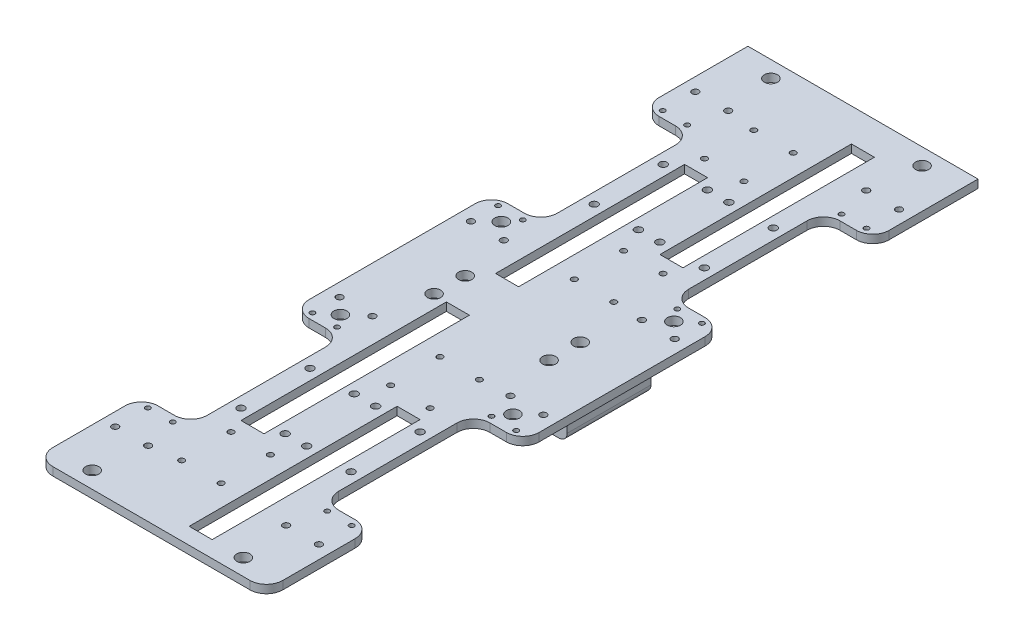
from build123d import *

# Parameters (mm, degrees)
SKETCH1_W           = 140
SKETCH1_H           = 340
BOSS_EXTRUDE1_DEPTH = 5
SKETCH3_W           = 30
SKETCH3_H           = 80
CUT_EXTRUDE1_DEPTH  = 184.915741577
SKETCH6_R           = 2.25
CUT_EXTRUDE2_DEPTH  = 184.915741577
SKETCH9_W           = 14
SKETCH9_H           = 55
CUT_EXTRUDE3_DEPTH  = 184.915741577
SKETCH10_W          = 14
SKETCH10_H          = 70
SKETCH10_H_2        = 60
CUT_EXTRUDE4_DEPTH  = 184.915741577
SKETCH12_W          = 140
SKETCH12_H          = 20
BOSS_EXTRUDE2_DEPTH = 5
SKETCH14_R          = 1.5
CUT_EXTRUDE6_DEPTH  = 203.546291005
SKETCH15_W          = 30
SKETCH15_H          = 6
CUT_EXTRUDE7_DEPTH  = 203.546291005
FILLET1_R           = 10
FILLET2_R           = 10
SKETCH17_W          = 140
SKETCH17_H          = 216.5
BOSS_EXTRUDE3_DEPTH = 5
MIRROR2_OUTLINE_W   = 14
MIRROR2_OUTLINE_H   = 116.526971263
MIRROR2_OUTLINE_H_2 = 115
MIRROR2_OUTLINE_R   = 2.25
MIRROR2_OUTLINE_R_2 = 1.5
MIRROR2_DEPTH       = 5
SKETCH20_R          = 1.75
CUT_EXTRUDE8_DEPTH  = 253.956732982
SKETCH21_R          = 2
CUT_EXTRUDE9_DEPTH  = 253.956732982
SKETCH22_W          = 20
SKETCH22_H          = 51
BOSS_EXTRUDE4_DEPTH = 17
SKETCH23_R          = 4
CUT_EXTRUDE10_DEPTH = 62
SKETCH24_W          = 26
SKETCH24_H          = 51
BOSS_EXTRUDE5_DEPTH = 17
SKETCH25_R          = 4
CUT_EXTRUDE11_DEPTH = 62
FILLET6_R           = 5
SKETCH26_R          = 4
CUT_EXTRUDE12_DEPTH = 254.86238154
SKETCH27_W          = 14
SKETCH27_H          = 10
CUT_EXTRUDE13_DEPTH = 10


# Read off the part's stored shape, not the designer's step: Mirror2
with BuildPart() as part:
    # Sketch1 → Boss-Extrude1 (new body)
    with BuildSketch(Plane(origin=(0, 0, 0), x_dir=(1, 0, 0), z_dir=(0, 1, 0))):
        Rectangle(SKETCH1_W, SKETCH1_H)
    extrude(amount=BOSS_EXTRUDE1_DEPTH)

    # Sketch3 → Cut-Extrude1 (cut, through all)
    with BuildSketch(Plane(origin=(0, 5, 0), x_dir=(1, 0, 0), z_dir=(0, 1, 0))):
        with Locations((-55, -80)):
            Rectangle(SKETCH3_W, SKETCH3_H)
        with Locations((55, -80)):
            Rectangle(SKETCH3_W, SKETCH3_H)
    extrude(amount=-CUT_EXTRUDE1_DEPTH, mode=Mode.SUBTRACT)

    # Sketch6 → Cut-Extrude2 (cut, through all)
    with BuildSketch(Plane(origin=(0, 0, 0), x_dir=(-1, 0, 0), z_dir=(0, -1, 0))):
        with Locations(Location((-33.5, -59.973028737, 0), (0, 0, 90))):
            Circle(SKETCH6_R)
        with Locations(Location((-33.5, -101.973028737, 0), (0, 0, 90))):
            Circle(SKETCH6_R)
        with Locations(Location((-6.446238439, -59.973028737, 0), (0, 0, 90))):
            Circle(SKETCH6_R)
        with Locations(Location((-6.446238439, -101.973028737, 0), (0, 0, 90))):
            Circle(SKETCH6_R)
        with Locations(Location((6.61862519, -101.973028737, 0), (0, 0, 90))):
            Circle(SKETCH6_R)
        with Locations(Location((6.61862519, -59.973028737, 0), (0, 0, 90))):
            Circle(SKETCH6_R)
        with Locations(Location((33.5, -59.973028737, 0), (0, 0, 90))):
            Circle(SKETCH6_R)
        with Locations(Location((33.5, -101.973028737, 0), (0, 0, 90))):
            Circle(SKETCH6_R)
    extrude(amount=-CUT_EXTRUDE2_DEPTH, mode=Mode.SUBTRACT)

    # Sketch9 → Cut-Extrude3 (cut, through all)
    with BuildSketch(Plane.XZ):
        with Locations((-20, 80.973028737)):
            Rectangle(SKETCH9_W, SKETCH9_H)
        with Locations((20, 80.973028737)):
            Rectangle(SKETCH9_W, SKETCH9_H)
    extrude(amount=-CUT_EXTRUDE3_DEPTH, mode=Mode.SUBTRACT)

    # Sketch10 → Cut-Extrude4 (cut, through all)
    with BuildSketch(Plane(origin=(0, 5, 0), x_dir=(1, 0, 0), z_dir=(0, 1, 0))):
        with Locations((20, -143.473028737)):
            Rectangle(SKETCH10_W, SKETCH10_H)
        with Locations((-20, -23.473028737)):
            Rectangle(SKETCH10_W, SKETCH10_H_2)
    extrude(amount=-CUT_EXTRUDE4_DEPTH, mode=Mode.SUBTRACT)

    # Sketch12 → Boss-Extrude2 (add)
    with BuildSketch(Plane(origin=(0, 0, 0), x_dir=(1, 0, 0), z_dir=(0, 1, 0))):
        with Locations((0, -180)):
            Rectangle(SKETCH12_W, SKETCH12_H)
    extrude(amount=BOSS_EXTRUDE2_DEPTH)

    # Sketch14 → Cut-Extrude6 (cut, through all)
    with BuildSketch(Plane(origin=(0, 5, 0), x_dir=(1, 0, 0), z_dir=(0, 1, 0))):
        with Locations(Location((-62, -30, 0), (0, 0, 270))):
            Circle(SKETCH14_R)
        with Locations(Location((-47, -30, 0), (0, 0, 270))):
            Circle(SKETCH14_R)
        with Locations(Location((47, -30, 0), (0, 0, 90))):
            Circle(SKETCH14_R)
        with Locations(Location((62, -30, 0), (0, 0, 90))):
            Circle(SKETCH14_R)
        with Locations(Location((-62, -130.169982871, 0), (0, 0, 270))):
            Circle(SKETCH14_R)
        with Locations(Location((-47, -130, 0), (0, 0, 270))):
            Circle(SKETCH14_R)
        with Locations(Location((47, -130, 0), (0, 0, 90))):
            Circle(SKETCH14_R)
        with Locations(Location((62, -130.169982871, 0), (0, 0, 90))):
            Circle(SKETCH14_R)
    extrude(amount=-CUT_EXTRUDE6_DEPTH, mode=Mode.SUBTRACT)

    # Sketch15 → Cut-Extrude7 (cut, through all)
    with BuildSketch(Plane(origin=(0, 5, 0), x_dir=(1, 0, 0), z_dir=(0, 1, 0))):
        with Locations((-55, -37)):
            Rectangle(SKETCH15_W, SKETCH15_H)
        with Locations((-55, -123)):
            Rectangle(SKETCH15_W, SKETCH15_H)
        with Locations((55, -37)):
            Rectangle(SKETCH15_W, SKETCH15_H)
        with Locations((55, -123)):
            Rectangle(SKETCH15_W, SKETCH15_H)
    extrude(amount=-CUT_EXTRUDE7_DEPTH, mode=Mode.SUBTRACT)

    # Fillet1
    fillet1_edges = [part.edges().sort_by_distance(p)[0] for p in [
        (-70, 2.5, 190),
        (70, 2.5, 190),
        (-70, 2.5, 126),
        (70, 2.5, 34),
        (70, 2.5, 126),
        (-70, 2.5, 34),
    ]]
    fillet(fillet1_edges, radius=FILLET1_R)

    # Fillet2
    fillet2_edges = [part.edges().sort_by_distance(p)[0] for p in [
        (-40, 2.5, 126),
        (40, 2.5, 34),
        (40, 2.5, 126),
        (-40, 2.5, 34),
    ]]
    fillet(fillet2_edges, radius=FILLET2_R)

    # Sketch17 → Boss-Extrude3 (add)
    with BuildSketch(Plane(origin=(0, 5, 0), x_dir=(1, 0, 0), z_dir=(0, 1, 0))):
        with Locations((0, 134.776971263)):
            Rectangle(SKETCH17_W, SKETCH17_H)
    extrude(amount=-BOSS_EXTRUDE3_DEPTH)

    # Mirror2 outline → Mirror2 (cut)
    with BuildSketch(Plane(origin=(0, 0, 0), x_dir=(1, 0, 0), z_dir=(0, 1, 0))):
        with BuildLine():
            Line((40, 169), (40, 97))
            ThreePointArc((40, 97), (42.928932188, 89.928932188), (50, 87))
            Line((50, 87), (60, 87))
            ThreePointArc((60, 87), (67.071067812, 84.071067812), (70, 77))
            Line((70, 77), (70, 189))
            ThreePointArc((70, 189), (67.071067812, 181.928932188), (60, 179))
            Line((60, 179), (50, 179))
            ThreePointArc((50, 179), (42.928932188, 176.071067812), (40, 169))
        make_face()
        with BuildLine():
            ThreePointArc((-50, 87), (-42.928932188, 89.928932188), (-40, 97))
            Line((-40, 97), (-40, 169))
            ThreePointArc((-40, 169), (-42.928932188, 176.071067812), (-50, 179))
            Line((-50, 179), (-60, 179))
            ThreePointArc((-60, 179), (-67.071067812, 181.928932188), (-70, 189))
            Line((-70, 189), (-70, 77))
            ThreePointArc((-70, 77), (-67.071067812, 84.071067812), (-60, 87))
            Line((-60, 87), (-50, 87))
        make_face()
        with Locations((20, 164.736514368)):
            Rectangle(MIRROR2_OUTLINE_W, MIRROR2_OUTLINE_H)
        with Locations((-20, 103.973028737)):
            Rectangle(MIRROR2_OUTLINE_W, MIRROR2_OUTLINE_H_2)
        with Locations((33.5, 112.973028737)):
            Circle(MIRROR2_OUTLINE_R)
        with Locations((-33.5, 154.973028737)):
            Circle(MIRROR2_OUTLINE_R)
        with Locations((-33.5, 112.973028737)):
            Circle(MIRROR2_OUTLINE_R)
        with Locations((-6.61862519, 112.973028737)):
            Circle(MIRROR2_OUTLINE_R)
        with Locations((33.5, 154.973028737)):
            Circle(MIRROR2_OUTLINE_R)
        with Locations((6.446238439, 112.973028737)):
            Circle(MIRROR2_OUTLINE_R)
        with Locations((6.446238439, 154.973028737)):
            Circle(MIRROR2_OUTLINE_R)
        with Locations((-6.61862519, 154.973028737)):
            Circle(MIRROR2_OUTLINE_R)
        with Locations((-62, 83)):
            Circle(MIRROR2_OUTLINE_R_2)
        with Locations((62, 183.169982871)):
            Circle(MIRROR2_OUTLINE_R_2)
        with Locations((47, 183)):
            Circle(MIRROR2_OUTLINE_R_2)
        with Locations((-47, 183)):
            Circle(MIRROR2_OUTLINE_R_2)
        with Locations((-47, 83)):
            Circle(MIRROR2_OUTLINE_R_2)
        with Locations((47, 83)):
            Circle(MIRROR2_OUTLINE_R_2)
        with Locations((62, 83)):
            Circle(MIRROR2_OUTLINE_R_2)
        with Locations((-62, 183.169982871)):
            Circle(MIRROR2_OUTLINE_R_2)
    extrude(amount=MIRROR2_DEPTH, mode=Mode.SUBTRACT)

    # Sketch20 → Cut-Extrude8 (cut, through all)
    with BuildSketch(Plane(origin=(0, 5, 0), x_dir=(1, 0, 0), z_dir=(0, 1, 0))):
        with Locations(Location((0, -14.373028737, 0), (0, 0, 270))):
            Circle(SKETCH20_R)
        with Locations(Location((24, -14.373028737, 0), (0, 0, 270))):
            Circle(SKETCH20_R)
        with Locations(Location((0, -44.373028737, 0), (0, 0, 270))):
            Circle(SKETCH20_R)
        with Locations(Location((24, -44.373028737, 0), (0, 0, 270))):
            Circle(SKETCH20_R)
        with Locations(Location((-24, -117.573028737, 0), (0, 0, 270))):
            Circle(SKETCH20_R)
        with Locations(Location((0, -117.573028737, 0), (0, 0, 270))):
            Circle(SKETCH20_R)
        with Locations(Location((-24, -147.573028737, 0), (0, 0, 270))):
            Circle(SKETCH20_R)
        with Locations(Location((0, -147.573028737, 0), (0, 0, 270))):
            Circle(SKETCH20_R)
    cut_extrude8 = extrude(amount=-CUT_EXTRUDE8_DEPTH, mode=Mode.SUBTRACT)

    # Sketch21 → Cut-Extrude9 (cut, through all)
    with BuildSketch(Plane(origin=(0, 5, 0), x_dir=(1, 0, 0), z_dir=(0, 1, 0))):
        with Locations(Location((-62, -13.473028737, 0), (0, 0, 270))):
            Circle(SKETCH21_R)
        with Locations(Location((-42, -13.473028737, 0), (0, 0, 270))):
            Circle(SKETCH21_R)
        with Locations(Location((-62, -150, 0), (0, 0, 270))):
            Circle(SKETCH21_R)
        with Locations(Location((-42, -150, 0), (0, 0, 270))):
            Circle(SKETCH21_R)
        with Locations(Location((42, -150, 0), (0, 0, 90))):
            Circle(SKETCH21_R)
        with Locations(Location((62, -150, 0), (0, 0, 90))):
            Circle(SKETCH21_R)
        with Locations(Location((42, -13.473028737, 0), (0, 0, 90))):
            Circle(SKETCH21_R)
        with Locations(Location((62, -13.473028737, 0), (0, 0, 90))):
            Circle(SKETCH21_R)
    cut_extrude9 = extrude(amount=-CUT_EXTRUDE9_DEPTH, mode=Mode.SUBTRACT)

    # Mirror3: Cut-Extrude8, Cut-Extrude9 across plane
    add(cut_extrude8.mirror(Plane.XY.offset(-26.5)), mode=Mode.SUBTRACT)
    add(cut_extrude9.mirror(Plane.XY.offset(-26.5)), mode=Mode.SUBTRACT)

    # Sketch22 → Boss-Extrude4 (add)
    with BuildSketch(Plane(origin=(0, 0, 0), x_dir=(-1, 0, 0), z_dir=(0, -1, 0))):
        with Locations((52, 26.5)):
            Rectangle(SKETCH22_W, SKETCH22_H)
        with Locations((-52, 26.5)):
            Rectangle(SKETCH22_W, SKETCH22_H)
    extrude(amount=BOSS_EXTRUDE4_DEPTH)

    # Sketch23 → Cut-Extrude10 (cut)
    with BuildSketch(Plane.XY.offset(-1)):
        with Locations((-52, -8.5)):
            Circle(SKETCH23_R)
        with Locations((52, -8.5)):
            Circle(SKETCH23_R)
    extrude(amount=-CUT_EXTRUDE10_DEPTH, mode=Mode.SUBTRACT)

    # Sketch24 → Boss-Extrude5 (add)
    with BuildSketch(Plane.XZ):
        with Locations((0, -26.586003802)):
            Rectangle(SKETCH24_W, SKETCH24_H)
    extrude(amount=BOSS_EXTRUDE5_DEPTH)

    # Sketch25 → Cut-Extrude11 (cut)
    with BuildSketch(Plane.XY.offset(-1.086003802)):
        with Locations((6.75, -8.5)):
            Circle(SKETCH25_R)
        with Locations((-6.75, -8.5)):
            Circle(SKETCH25_R)
    extrude(amount=-CUT_EXTRUDE11_DEPTH, mode=Mode.SUBTRACT)

    # Fillet6
    fillet6_edges = [part.edges().sort_by_distance(p)[0] for p in [
        (-62, -17, -26.5),
        (-42, -17, -26.5),
        (62, -17, -26.5),
        (42, -17, -26.5),
        (-13, -17, -26.586003802),
        (13, -17, -26.586003802),
    ]]
    fillet(fillet6_edges, radius=FILLET6_R)

    # Sketch26 → Cut-Extrude12 (cut, through all)
    with BuildSketch(Plane(origin=(0, 5, 0), x_dir=(1, 0, 0), z_dir=(0, 1, 0))):
        with Locations(Location((-35, 17.026971263, 0), (0, 0, 270))):
            Circle(SKETCH26_R)
        with Locations(Location((-52.5, -22.473028737, 0), (0, 0, 270))):
            Circle(SKETCH26_R)
        with Locations(Location((35, 17.026971263, 0), (0, 0, 270))):
            Circle(SKETCH26_R)
        with Locations(Location((52.5, -22.473028737, 0), (0, 0, 270))):
            Circle(SKETCH26_R)
        with Locations(Location((-46, -180, 0), (0, 0, 270))):
            Circle(SKETCH26_R)
        with Locations(Location((46, -180, 0), (0, 0, 270))):
            Circle(SKETCH26_R)
    cut_extrude12 = extrude(amount=-CUT_EXTRUDE12_DEPTH, mode=Mode.SUBTRACT)

    # Mirror4: Cut-Extrude12 across plane
    add(cut_extrude12.mirror(Plane.XY.offset(-26.5)), mode=Mode.SUBTRACT)

    # Sketch27 → Cut-Extrude13 (cut)
    with BuildSketch(Plane(origin=(0, 5, 0), x_dir=(1, 0, 0), z_dir=(0, 1, 0))):
        with Locations((20, -175)):
            Rectangle(SKETCH27_W, SKETCH27_H)
        with Locations((-20, 11.526971263)):
            Rectangle(SKETCH27_W, SKETCH27_H)
    extrude(amount=-CUT_EXTRUDE13_DEPTH, mode=Mode.SUBTRACT)


solid = part.part
